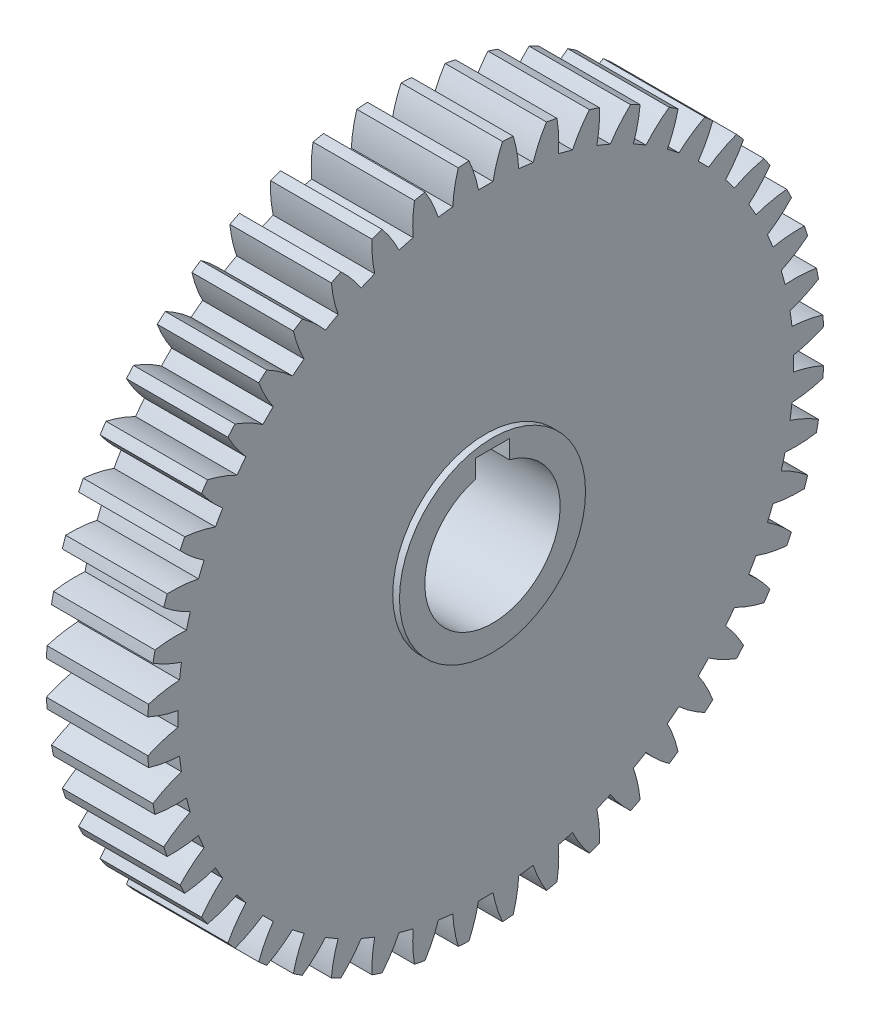
from build123d import *

# Parameters (mm, degrees)
SPUR_START          = -41.119252503
SPUR_GEAR_AI_DEPTH  = 9.525
SKETCH1_R           = 8.73125
BOSS_EXTRUDE1_DEPTH = 0.635


# Read off the part's stored shape, not the designer's step: spur gear_ai
with BuildPart() as part:
    # spur gear_ai outline → spur gear_ai (new body)
    with BuildSketch(Plane.YZ.offset(SPUR_START)):
        with BuildLine():
            ThreePointArc((35.939392609, 11.682273064), (36.04126481, 12.17405867), (36.135345373, 12.66739413))
            ThreePointArc((36.135345373, 12.66739413), (34.836581247, 13.373763653), (33.461867718, 13.917738719))
            ThreePointArc((33.461867718, 13.917738719), (33.559244164, 14.595290704), (33.640549097, 15.274958543))
            ThreePointArc((33.640549097, 15.274958543), (35.109211506, 15.444596065), (36.546543203, 15.790751739))
            ThreePointArc((36.546543203, 15.790751739), (36.58335297, 16.291627042), (36.612235461, 16.793021926))
            ThreePointArc((36.612235461, 16.793021926), (35.232382718, 17.323825623), (33.79842706, 17.683710785))
            ThreePointArc((33.79842706, 17.683710785), (33.806532157, 18.368176395), (33.79842706, 19.052642005))
            ThreePointArc((33.79842706, 19.052642005), (35.232382718, 19.412527166), (36.612235461, 19.943330864))
            ThreePointArc((36.612235461, 19.943330864), (36.58335297, 20.444725748), (36.546543203, 20.945601051))
            ThreePointArc((36.546543203, 20.945601051), (35.109211506, 21.291756725), (33.640549097, 21.461394247))
            ThreePointArc((33.640549097, 21.461394247), (33.559244164, 22.141062086), (33.461867718, 22.818614071))
            ThreePointArc((33.461867718, 22.818614071), (34.836581247, 23.362589136), (36.135345373, 24.068958659))
            ThreePointArc((36.135345373, 24.068958659), (36.04126481, 24.562294119), (35.939392609, 25.054079725))
            ThreePointArc((35.939392609, 25.054079725), (34.469175102, 25.209664556), (32.990935164, 25.186151894))
            ThreePointArc((32.990935164, 25.186151894), (32.821611351, 25.849392657), (32.636629693, 26.508437914))
            ThreePointArc((32.636629693, 26.508437914), (33.928579363, 27.22719532), (35.124032658, 28.097044489))
            ThreePointArc((35.124032658, 28.097044489), (34.966363768, 28.573879418), (34.801172196, 29.04816074))
            ThreePointArc((34.801172196, 29.04816074), (33.323224708, 29.010512628), (31.860700336, 28.79425209))
            ThreePointArc((31.860700336, 28.79425209), (31.60625482, 29.429717544), (31.336833038, 30.058979626))
            ThreePointArc((31.336833038, 30.058979626), (32.523913232, 30.940221233), (33.595601159, 31.958666689))
            ThreePointArc((33.595601159, 31.958666689), (33.3770417, 32.410842309), (33.15135723, 32.859504262))
            ThreePointArc((33.15135723, 32.859504262), (31.690967852, 32.629267377), (30.269183244, 32.22395924))
            ThreePointArc((30.269183244, 32.22395924), (29.933969658, 32.820776395), (29.584717634, 33.409488453))
            ThreePointArc((29.584717634, 33.409488453), (30.646617081, 34.438135974), (31.576202761, 35.587751832))
            ThreePointArc((31.576202761, 35.587751832), (31.300492347, 36.007531293), (31.018176503, 36.422897146))
            ThreePointArc((31.018176503, 36.422897146), (29.600332902, 36.004010905), (28.243615186, 35.416590104))
            ThreePointArc((28.243615186, 35.416590104), (27.833369129, 35.964547252), (27.41026266, 36.50263626))
            ThreePointArc((27.41026266, 36.50263626), (28.328811966, 37.661089251), (29.100389932, 38.922205265))
            ThreePointArc((29.100389932, 38.922205265), (28.772246044, 39.302406024), (28.438129328, 39.677368752))
            ThreePointArc((28.438129328, 39.677368752), (27.087091202, 39.077000415), (25.818654194, 38.317517883))
            ThreePointArc((25.818654194, 38.317517883), (25.340395088, 38.807239326), (24.850673645, 39.285498432))
            ThreePointArc((24.850673645, 39.285498432), (25.610156177, 40.55393544), (26.210524515, 41.904973565))
            ThreePointArc((26.210524515, 41.904973565), (25.835561786, 42.239090282), (25.455361027, 42.56723417))
            ThreePointArc((25.455361027, 42.56723417), (24.194245013, 41.795656204), (23.035792023, 40.877106898))
            ThreePointArc((23.035792023, 40.877106898), (22.497703015, 41.300213366), (21.949745866, 41.710459424))
            ThreePointArc((21.949745866, 41.710459424), (22.537166667, 43.06717714), (22.956052908, 44.485020741))
            ThreePointArc((22.956052908, 44.485020741), (22.540687055, 44.767336585), (22.120907594, 45.043046999))
            ThreePointArc((22.120907594, 45.043046999), (20.971291736, 44.113461319), (19.942644215, 43.051561872))
            ThreePointArc((19.942644215, 43.051561872), (19.353932157, 43.400813896), (18.757115002, 43.736027482))
            ThreePointArc((18.757115002, 43.736027482), (19.162423139, 45.15781209), (19.392660024, 46.618201468))
            ThreePointArc((19.392660024, 46.618201468), (18.943998071, 46.843885938), (18.491822451, 47.062445397))
            ThreePointArc((18.491822451, 47.062445397), (17.473376995, 45.99075747), (16.592135388, 44.803677276))
            ThreePointArc((16.592135388, 44.803677276), (15.962873306, 45.073099058), (15.327407852, 45.327544574))
            ThreePointArc((15.327407852, 45.327544574), (15.54366839, 46.790068946), (15.581316502, 48.268016434))
            ThreePointArc((15.581316502, 48.268016434), (15.10703518, 48.433208006), (14.630200251, 48.590876896))
            ThreePointArc((14.630200251, 48.590876896), (13.760351082, 47.395423601), (13.041593676, 46.103473931))
            ThreePointArc((13.041593676, 46.103473931), (12.382548419, 46.288455589), (11.719307656, 46.457779402))
            ThreePointArc((11.719307656, 46.457779402), (11.742820318, 47.93601934), (11.587235487, 49.406236847))
            ThreePointArc((11.587235487, 49.406236847), (11.09544988, 49.508109047), (10.602114421, 49.602189611))
            ThreePointArc((10.602114421, 49.602189611), (9.895744898, 48.303425485), (9.351769833, 46.928711956))
            ThreePointArc((9.351769833, 46.928711956), (8.674217848, 47.026088402), (7.994550009, 47.107393335))
            ThreePointArc((7.994550009, 47.107393335), (7.824912487, 48.576055744), (7.478756813, 50.013387441))
            ThreePointArc((7.478756813, 50.013387441), (6.97788151, 50.050197207), (6.476486626, 50.079079699))
            ThreePointArc((6.476486626, 50.079079699), (5.945682928, 48.699226956), (5.585797767, 47.265271298))
            ThreePointArc((5.585797767, 47.265271298), (4.901332157, 47.273376395), (4.216866547, 47.265271298))
            ThreePointArc((4.216866547, 47.265271298), (3.856981385, 48.699226956), (3.326177688, 50.079079699))
            ThreePointArc((3.326177688, 50.079079699), (2.824782804, 50.050197207), (2.323907501, 50.013387441))
            ThreePointArc((2.323907501, 50.013387441), (1.977751827, 48.576055744), (1.808114305, 47.107393335))
            ThreePointArc((1.808114305, 47.107393335), (1.128446466, 47.026088402), (0.450894481, 46.928711956))
            ThreePointArc((0.450894481, 46.928711956), (-0.093080585, 48.303425485), (-0.799450108, 49.602189611))
            ThreePointArc((-0.799450108, 49.602189611), (-1.292785567, 49.508109047), (-1.784571174, 49.406236847))
            ThreePointArc((-1.784571174, 49.406236847), (-1.940156005, 47.93601934), (-1.916643342, 46.457779402))
            ThreePointArc((-1.916643342, 46.457779402), (-2.579884105, 46.288455589), (-3.238929362, 46.103473931))
            ThreePointArc((-3.238929362, 46.103473931), (-3.957686768, 47.395423601), (-4.827535938, 48.590876896))
            ThreePointArc((-4.827535938, 48.590876896), (-5.304370867, 48.433208006), (-5.778652189, 48.268016434))
            ThreePointArc((-5.778652189, 48.268016434), (-5.741004077, 46.790068946), (-5.524743538, 45.327544574))
            ThreePointArc((-5.524743538, 45.327544574), (-6.160208992, 45.073099058), (-6.789471074, 44.803677276))
            ThreePointArc((-6.789471074, 44.803677276), (-7.670712682, 45.99075747), (-8.689158138, 47.062445397))
            ThreePointArc((-8.689158138, 47.062445397), (-9.141333757, 46.843885938), (-9.58999571, 46.618201468))
            ThreePointArc((-9.58999571, 46.618201468), (-9.359758825, 45.15781209), (-8.954450689, 43.736027482))
            ThreePointArc((-8.954450689, 43.736027482), (-9.551267843, 43.400813896), (-10.139979901, 43.051561872))
            ThreePointArc((-10.139979901, 43.051561872), (-11.168627423, 44.113461319), (-12.318243281, 45.043046999))
            ThreePointArc((-12.318243281, 45.043046999), (-12.738022742, 44.767336585), (-13.153388595, 44.485020741))
            ThreePointArc((-13.153388595, 44.485020741), (-12.734502353, 43.067177141), (-12.147081553, 41.710459424))
            ThreePointArc((-12.147081553, 41.710459424), (-12.695038701, 41.300213366), (-13.233127709, 40.877106898))
            ThreePointArc((-13.233127709, 40.877106898), (-14.391580699, 41.795656204), (-15.652696714, 42.56723417))
            ThreePointArc((-15.652696714, 42.56723417), (-16.032897473, 42.239090282), (-16.407860201, 41.904973565))
            ThreePointArc((-16.407860201, 41.904973565), (-15.807491863, 40.55393544), (-15.048009332, 39.285498432))
            ThreePointArc((-15.048009332, 39.285498432), (-15.537730775, 38.807239326), (-16.015989881, 38.317517883))
            ThreePointArc((-16.015989881, 38.317517883), (-17.284426888, 39.077000415), (-18.635465014, 39.677368752))
            ThreePointArc((-18.635465014, 39.677368752), (-18.969581731, 39.302406024), (-19.297725618, 38.922205265))
            ThreePointArc((-19.297725618, 38.922205265), (-18.526147653, 37.661089251), (-17.607598347, 36.50263626))
            ThreePointArc((-17.607598347, 36.50263626), (-18.030704815, 35.964547252), (-18.440950873, 35.416590104))
            ThreePointArc((-18.440950873, 35.416590104), (-19.797668589, 36.004010905), (-21.215512189, 36.422897146))
            ThreePointArc((-21.215512189, 36.422897146), (-21.497828034, 36.007531293), (-21.773538448, 35.587751832))
            ThreePointArc((-21.773538448, 35.587751832), (-20.843952767, 34.438135974), (-19.78205332, 33.409488453))
            ThreePointArc((-19.78205332, 33.409488453), (-20.131305345, 32.820776395), (-20.46651893, 32.22395924))
            ThreePointArc((-20.46651893, 32.22395924), (-21.888303539, 32.629267377), (-23.348692917, 32.859504262))
            ThreePointArc((-23.348692917, 32.859504262), (-23.574377387, 32.410842309), (-23.792936845, 31.958666689))
            ThreePointArc((-23.792936845, 31.958666689), (-22.721248919, 30.940221233), (-21.534168725, 30.058979626))
            ThreePointArc((-21.534168725, 30.058979626), (-21.803590506, 29.429717544), (-22.058036023, 28.79425209))
            ThreePointArc((-22.058036023, 28.79425209), (-23.520560395, 29.010512628), (-24.998507883, 29.04816074))
            ThreePointArc((-24.998507883, 29.04816074), (-25.163699455, 28.573879418), (-25.321368345, 28.097044489))
            ThreePointArc((-25.321368345, 28.097044489), (-24.12591505, 27.22719532), (-22.83396538, 26.508437914))
            ThreePointArc((-22.83396538, 26.508437914), (-23.018947037, 25.849392657), (-23.188270851, 25.186151894))
            ThreePointArc((-23.188270851, 25.186151894), (-24.666510789, 25.209664556), (-26.136728296, 25.054079725))
            ThreePointArc((-26.136728296, 25.054079725), (-26.238600496, 24.562294118), (-26.332681059, 24.068958659))
            ThreePointArc((-26.332681059, 24.068958659), (-25.033916933, 23.362589136), (-23.659203404, 22.818614071))
            ThreePointArc((-23.659203404, 22.818614071), (-23.75657985, 22.141062086), (-23.837884784, 21.461394247))
            ThreePointArc((-23.837884784, 21.461394247), (-25.306547192, 21.291756725), (-26.743878889, 20.945601051))
            ThreePointArc((-26.743878889, 20.945601051), (-26.780688656, 20.444725748), (-26.809571148, 19.943330864))
            ThreePointArc((-26.809571148, 19.943330864), (-25.429718405, 19.412527166), (-23.995762747, 19.052642005))
            ThreePointArc((-23.995762747, 19.052642005), (-24.003867843, 18.368176395), (-23.995762747, 17.683710785))
            ThreePointArc((-23.995762747, 17.683710785), (-25.429718405, 17.323825623), (-26.809571148, 16.793021926))
            ThreePointArc((-26.809571148, 16.793021926), (-26.780688656, 16.291627042), (-26.743878889, 15.790751739))
            ThreePointArc((-26.743878889, 15.790751739), (-25.306547192, 15.444596065), (-23.837884784, 15.274958543))
            ThreePointArc((-23.837884784, 15.274958543), (-23.75657985, 14.595290704), (-23.659203404, 13.917738719))
            ThreePointArc((-23.659203404, 13.917738719), (-25.033916933, 13.373763653), (-26.332681059, 12.66739413))
            ThreePointArc((-26.332681059, 12.66739413), (-26.238600496, 12.174058671), (-26.136728296, 11.682273064))
            ThreePointArc((-26.136728296, 11.682273064), (-24.666510789, 11.526688233), (-23.188270851, 11.550200895))
            ThreePointArc((-23.188270851, 11.550200895), (-23.018947037, 10.886960132), (-22.83396538, 10.227914875))
            ThreePointArc((-22.83396538, 10.227914875), (-24.12591505, 9.509157469), (-25.321368345, 8.6393083))
            ThreePointArc((-25.321368345, 8.6393083), (-25.163699455, 8.162473371), (-24.998507883, 7.688192049))
            ThreePointArc((-24.998507883, 7.688192049), (-23.520560395, 7.725840161), (-22.058036023, 7.942100699))
            ThreePointArc((-22.058036023, 7.942100699), (-21.803590506, 7.306635246), (-21.534168725, 6.677373164))
            ThreePointArc((-21.534168725, 6.677373164), (-22.721248919, 5.796131556), (-23.792936845, 4.7776861))
            ThreePointArc((-23.792936845, 4.7776861), (-23.574377387, 4.32551048), (-23.348692917, 3.876848527))
            ThreePointArc((-23.348692917, 3.876848527), (-21.888303539, 4.107085412), (-20.46651893, 4.512393549))
            ThreePointArc((-20.46651893, 4.512393549), (-20.131305345, 3.915576394), (-19.78205332, 3.326864336))
            ThreePointArc((-19.78205332, 3.326864336), (-20.843952767, 2.298216815), (-21.773538448, 1.148600957))
            ThreePointArc((-21.773538448, 1.148600957), (-21.497828034, 0.728821496), (-21.215512189, 0.313455643))
            ThreePointArc((-21.215512189, 0.313455643), (-19.797668589, 0.732341885), (-18.440950873, 1.319762685))
            ThreePointArc((-18.440950873, 1.319762685), (-18.030704815, 0.771805537), (-17.607598347, 0.233716529))
            ThreePointArc((-17.607598347, 0.233716529), (-18.526147653, -0.924736462), (-19.297725618, -2.185852476))
            ThreePointArc((-19.297725618, -2.185852476), (-18.969581731, -2.566053235), (-18.635465014, -2.941015963))
            ThreePointArc((-18.635465014, -2.941015963), (-17.284426889, -2.340647625), (-16.015989881, -1.581165094))
            ThreePointArc((-16.015989881, -1.581165094), (-15.537730775, -2.070886537), (-15.048009332, -2.549145643))
            ThreePointArc((-15.048009332, -2.549145643), (-15.807491863, -3.817582651), (-16.407860201, -5.168620776))
            ThreePointArc((-16.407860201, -5.168620776), (-16.032897473, -5.502737493), (-15.652696714, -5.83088138))
            ThreePointArc((-15.652696714, -5.83088138), (-14.391580699, -5.059303415), (-13.233127709, -4.140754109))
            ThreePointArc((-13.233127709, -4.140754109), (-12.695038701, -4.563860577), (-12.147081553, -4.974106635))
            ThreePointArc((-12.147081553, -4.974106635), (-12.734502353, -6.330824351), (-13.153388595, -7.748667951))
            ThreePointArc((-13.153388595, -7.748667951), (-12.738022742, -8.030983796), (-12.318243281, -8.30669421))
            ThreePointArc((-12.318243281, -8.30669421), (-11.168627423, -7.377108529), (-10.139979901, -6.315209082))
            ThreePointArc((-10.139979901, -6.315209082), (-9.551267843, -6.664461107), (-8.954450689, -6.999674693))
            ThreePointArc((-8.954450689, -6.999674693), (-9.359758825, -8.421459301), (-9.58999571, -9.881848679))
            ThreePointArc((-9.58999571, -9.881848679), (-9.141333758, -10.107533149), (-8.689158138, -10.326092607))
            ThreePointArc((-8.689158138, -10.326092607), (-7.670712682, -9.254404681), (-6.789471074, -8.067324487))
            ThreePointArc((-6.789471074, -8.067324487), (-6.160208992, -8.336746268), (-5.524743538, -8.591191785))
            ThreePointArc((-5.524743538, -8.591191785), (-5.741004077, -10.053716157), (-5.778652189, -11.531663645))
            ThreePointArc((-5.778652189, -11.531663645), (-5.304370867, -11.696855217), (-4.827535938, -11.854524107))
            ThreePointArc((-4.827535938, -11.854524107), (-3.957686768, -10.659070812), (-3.238929362, -9.367121142))
            ThreePointArc((-3.238929362, -9.367121142), (-2.579884105, -9.552102799), (-1.916643342, -9.721426613))
            ThreePointArc((-1.916643342, -9.721426613), (-1.940156005, -11.199666551), (-1.784571174, -12.669884058))
            ThreePointArc((-1.784571174, -12.669884058), (-1.292785567, -12.771756258), (-0.799450108, -12.865836821))
            ThreePointArc((-0.799450108, -12.865836821), (-0.093080585, -11.567072695), (0.450894481, -10.192359166))
            ThreePointArc((0.450894481, -10.192359166), (1.128446466, -10.289735612), (1.808114305, -10.371040546))
            ThreePointArc((1.808114305, -10.371040546), (1.977751827, -11.839702954), (2.323907501, -13.277034651))
            ThreePointArc((2.323907501, -13.277034651), (2.824782804, -13.313844418), (3.326177688, -13.34272691))
            ThreePointArc((3.326177688, -13.34272691), (3.856981385, -11.962874167), (4.216866547, -10.528918509))
            ThreePointArc((4.216866547, -10.528918509), (4.901332157, -10.537023605), (5.585797767, -10.528918509))
            ThreePointArc((5.585797767, -10.528918509), (5.945682928, -11.962874167), (6.476486626, -13.34272691))
            ThreePointArc((6.476486626, -13.34272691), (6.97788151, -13.313844418), (7.478756813, -13.277034651))
            ThreePointArc((7.478756813, -13.277034651), (7.824912487, -11.839702954), (7.994550009, -10.371040546))
            ThreePointArc((7.994550009, -10.371040546), (8.674217848, -10.289735612), (9.351769833, -10.192359166))
            ThreePointArc((9.351769833, -10.192359166), (9.895744898, -11.567072695), (10.602114421, -12.865836821))
            ThreePointArc((10.602114421, -12.865836821), (11.09544988, -12.771756258), (11.587235487, -12.669884058))
            ThreePointArc((11.587235487, -12.669884058), (11.742820318, -11.199666551), (11.719307656, -9.721426613))
            ThreePointArc((11.719307656, -9.721426613), (12.382548419, -9.552102799), (13.041593676, -9.367121142))
            ThreePointArc((13.041593676, -9.367121142), (13.760351082, -10.659070812), (14.630200251, -11.854524107))
            ThreePointArc((14.630200251, -11.854524107), (15.10703518, -11.696855217), (15.581316502, -11.531663645))
            ThreePointArc((15.581316502, -11.531663645), (15.54366839, -10.053716157), (15.327407852, -8.591191785))
            ThreePointArc((15.327407852, -8.591191785), (15.962873306, -8.336746268), (16.592135388, -8.067324487))
            ThreePointArc((16.592135388, -8.067324487), (17.473376995, -9.254404681), (18.491822451, -10.326092607))
            ThreePointArc((18.491822451, -10.326092607), (18.943998071, -10.107533149), (19.392660024, -9.881848679))
            ThreePointArc((19.392660024, -9.881848679), (19.162423139, -8.421459301), (18.757115002, -6.999674693))
            ThreePointArc((18.757115002, -6.999674693), (19.353932157, -6.664461107), (19.942644215, -6.315209082))
            ThreePointArc((19.942644215, -6.315209082), (20.971291736, -7.377108529), (22.120907594, -8.30669421))
            ThreePointArc((22.120907594, -8.30669421), (22.540687055, -8.030983796), (22.956052908, -7.748667951))
            ThreePointArc((22.956052908, -7.748667951), (22.537166667, -6.330824351), (21.949745866, -4.974106635))
            ThreePointArc((21.949745866, -4.974106635), (22.497703015, -4.563860577), (23.035792023, -4.140754109))
            ThreePointArc((23.035792023, -4.140754109), (24.194245013, -5.059303415), (25.455361027, -5.83088138))
            ThreePointArc((25.455361027, -5.83088138), (25.835561786, -5.502737493), (26.210524515, -5.168620776))
            ThreePointArc((26.210524515, -5.168620776), (25.610156177, -3.81758265), (24.850673645, -2.549145643))
            ThreePointArc((24.850673645, -2.549145643), (25.340395088, -2.070886537), (25.818654194, -1.581165094))
            ThreePointArc((25.818654194, -1.581165094), (27.087091202, -2.340647625), (28.438129328, -2.941015963))
            ThreePointArc((28.438129328, -2.941015963), (28.772246044, -2.566053235), (29.100389932, -2.185852476))
            ThreePointArc((29.100389932, -2.185852476), (28.328811966, -0.924736462), (27.41026266, 0.233716529))
            ThreePointArc((27.41026266, 0.233716529), (27.833369129, 0.771805537), (28.243615186, 1.319762685))
            ThreePointArc((28.243615186, 1.319762685), (29.600332903, 0.732341885), (31.018176503, 0.313455643))
            ThreePointArc((31.018176503, 0.313455643), (31.300492347, 0.728821496), (31.576202761, 1.148600957))
            ThreePointArc((31.576202761, 1.148600957), (30.646617081, 2.298216815), (29.584717634, 3.326864336))
            ThreePointArc((29.584717634, 3.326864336), (29.933969658, 3.915576395), (30.269183244, 4.512393549))
            ThreePointArc((30.269183244, 4.512393549), (31.690967852, 4.107085412), (33.15135723, 3.876848527))
            ThreePointArc((33.15135723, 3.876848527), (33.3770417, 4.32551048), (33.595601159, 4.7776861))
            ThreePointArc((33.595601159, 4.7776861), (32.523913232, 5.796131556), (31.336833038, 6.677373164))
            ThreePointArc((31.336833038, 6.677373164), (31.60625482, 7.306635245), (31.860700336, 7.942100699))
            ThreePointArc((31.860700336, 7.942100699), (33.323224708, 7.725840161), (34.801172196, 7.688192049))
            ThreePointArc((34.801172196, 7.688192049), (34.966363768, 8.162473371), (35.124032658, 8.6393083))
            ThreePointArc((35.124032658, 8.6393083), (33.928579363, 9.509157469), (32.636629693, 10.227914875))
            ThreePointArc((32.636629693, 10.227914875), (32.821611351, 10.886960132), (32.990935164, 11.550200895))
            ThreePointArc((32.990935164, 11.550200895), (34.469175102, 11.526688233), (35.939392609, 11.682273064))
        make_face()
        with BuildLine():
            Line((12.775332157, 16.780676395), (11.049693219, 16.780676395))
            ThreePointArc((11.049693219, 16.780676395), (-1.448667843, 18.368176395), (11.049693219, 19.955676395))
            Line((11.049693219, 19.955676395), (12.775332157, 19.955676395))
            Line((12.775332157, 19.955676395), (12.775332157, 16.780676395))
        make_face(mode=Mode.SUBTRACT)
    extrude(amount=SPUR_GEAR_AI_DEPTH)

    # Sketch1 → Boss-Extrude1 (add)
    with BuildSketch(Plane(origin=(-31.594252503, 0, 0), x_dir=(0, 0, -1), z_dir=(1, 0, 0))):
        with Locations(Location((-18.368176395, 4.901332157, 0), (0, 0, 180))):
            Circle(SKETCH1_R)
        with BuildLine():
            Line((-16.780676395, 11.049693219), (-16.780676395, 12.775332157))
            Line((-16.780676395, 12.775332157), (-19.955676395, 12.775332157))
            Line((-19.955676395, 12.775332157), (-19.955676395, 11.049693219))
            ThreePointArc((-19.955676395, 11.049693219), (-18.368176395, -1.448667843), (-16.780676395, 11.049693219))
        make_face(mode=Mode.SUBTRACT)
    extrude(amount=BOSS_EXTRUDE1_DEPTH)


solid = part.part
